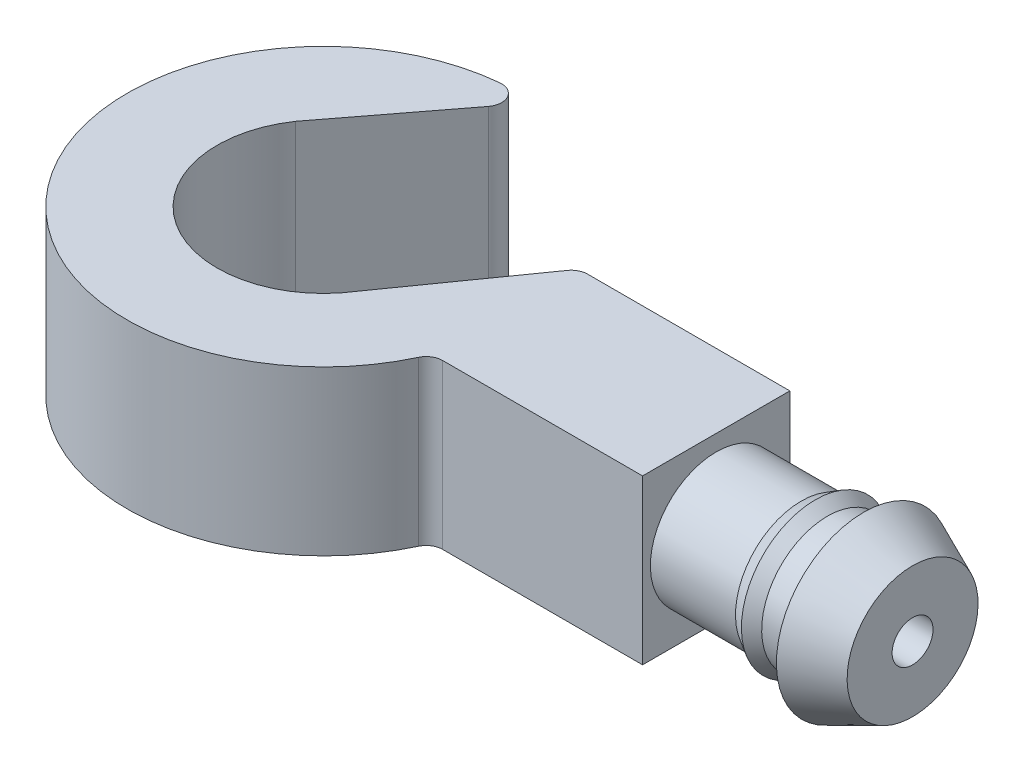
from build123d import *

# Parameters (mm, degrees)
SKETCH2_W                            = 15.24
SKETCH2_H                            = 11.43
BOSS_EXTRUDE2_DEPTH                  = 12.7
F_10_32_TAPPED_HOLE1_D               = 4.0386
F_10_32_TAPPED_HOLE1_DEPTH           = 7.112
F_10_32_TAPPED_HOLE1_TIP             = 1.213317848
F_1_8_START                          = -1.927032922
F_1_8_0_125_DIAMETER_HOLE1_OUTLINE_R = 1.5875
F_1_8_0_125_DIAMETER_HOLE1_DEPTH     = 17.167008702
F_1_8_0_125_DIAMETER_HOLE1_2_ANGLE   = 43.851778
BOSS_EXTRUDE4_DEPTH                  = 12.7
FILLET3_R                            = 1.27


with BuildPart() as part:
    # Sketch2 → Boss-Extrude2 (new body)
    with BuildSketch(Plane(origin=(0, 0, 0), x_dir=(1, 0, 0), z_dir=(0, 1, 0))):
        with Locations((-7.62, 0)):
            Rectangle(SKETCH2_W, SKETCH2_H)
    extrude(amount=BOSS_EXTRUDE2_DEPTH)

    # #10-32 Tapped Hole1
    with Locations(Plane(origin=(0, 0, -5.715), x_dir=(-1, 0, 0), z_dir=(0, 0, -1))):
        with Locations((3.175, 6.35)):
            Hole(F_10_32_TAPPED_HOLE1_D / 2, depth=F_10_32_TAPPED_HOLE1_DEPTH)
            with Locations((0, 0, -(F_10_32_TAPPED_HOLE1_DEPTH + F_10_32_TAPPED_HOLE1_TIP / 2))):  # 118° drill point
                Cone(0, F_10_32_TAPPED_HOLE1_D / 2, F_10_32_TAPPED_HOLE1_TIP, mode=Mode.SUBTRACT)

    # Sketch3 → Revolve1 (revolve)
    with BuildSketch(Plane.XY):
        Polygon((0, 6.35), (0, 11.457170435), (3.81, 11.457170435), (6.60398789, 11.457170435), (7.698956629, 12.092170435), (8.63598789, 11.457170435), (11.42997578, 11.457170435), (11.42997578, 13.108170435), (15.23997578, 11.43), (15.23997578, 6.35), align=None)
    revolve(axis=Axis((15.23997578, 6.35, 0), (-1, 0, 0)))

    # 1/8 (0.125) Diameter Hole1: read off the stored shape, not the designer's step
    # 1/8 (0.125) Diameter Hole1 outline → 1/8 (0.125) Diameter Hole1 (cut)
    with BuildSketch(Plane.YZ.offset(F_1_8_START)):
        with Locations((6.35, 0)):
            Circle(F_1_8_0_125_DIAMETER_HOLE1_OUTLINE_R)
    extrude(amount=F_1_8_0_125_DIAMETER_HOLE1_DEPTH, mode=Mode.SUBTRACT)

    # 1_8 _0.125_ Diameter Hole1 2 outline → 1_8 _0.125_ Diameter Hole1 2 (revolve)
    with BuildSketch(Plane(origin=(-3.175, 6.35, 0), x_dir=(0.9276676260373513, -0.3734069838691089, 0), z_dir=(-0.3734069838691089, -0.9276676260373513, 0))):
        Polygon((2.0193, 1.587640849), (1.702020347, 1.587640849), (2.0193, 1.397), align=None)
    revolve(axis=Axis((-3.175, 6.35, 0), (0, 0, 1)), revolution_arc=F_1_8_0_125_DIAMETER_HOLE1_2_ANGLE)

    # Sketch12 → Boss-Extrude4 (add)
    with BuildSketch(Plane(origin=(0, 0, 0), x_dir=(1, 0, 0), z_dir=(0, 1, 0))):
        with BuildLine():
            Line((-15.24, 5.715), (-16.352141882, 5.715))
            Line((-16.352141882, 5.715), (-23.999818432, -5.113929199))
            ThreePointArc((-23.999818432, -5.113929199), (-35.367933104, -6.652302982), (-37.296546478, 4.656148527))
            Line((-37.296546478, 4.656148527), (-29.247375355, 15.190070325))
            ThreePointArc((-29.247375355, 15.190070325), (-43.450797932, -8.001), (-16.352141882, -5.715))
            Line((-16.352141882, -5.715), (-15.24, -5.715))
            Line((-15.24, -5.715), (-15.24, 5.715))
        make_face()
    extrude(amount=BOSS_EXTRUDE4_DEPTH)

    # Fillet3
    fillet3_edges = [part.edges().sort_by_distance(p)[0] for p in [
        (-29.247375355, 6.35, -15.190070325),
        (-16.352141882, 6.35, 5.715),
        (-16.352141882, 6.35, -5.715),
    ]]
    fillet(fillet3_edges, radius=FILLET3_R)


solid = part.part
